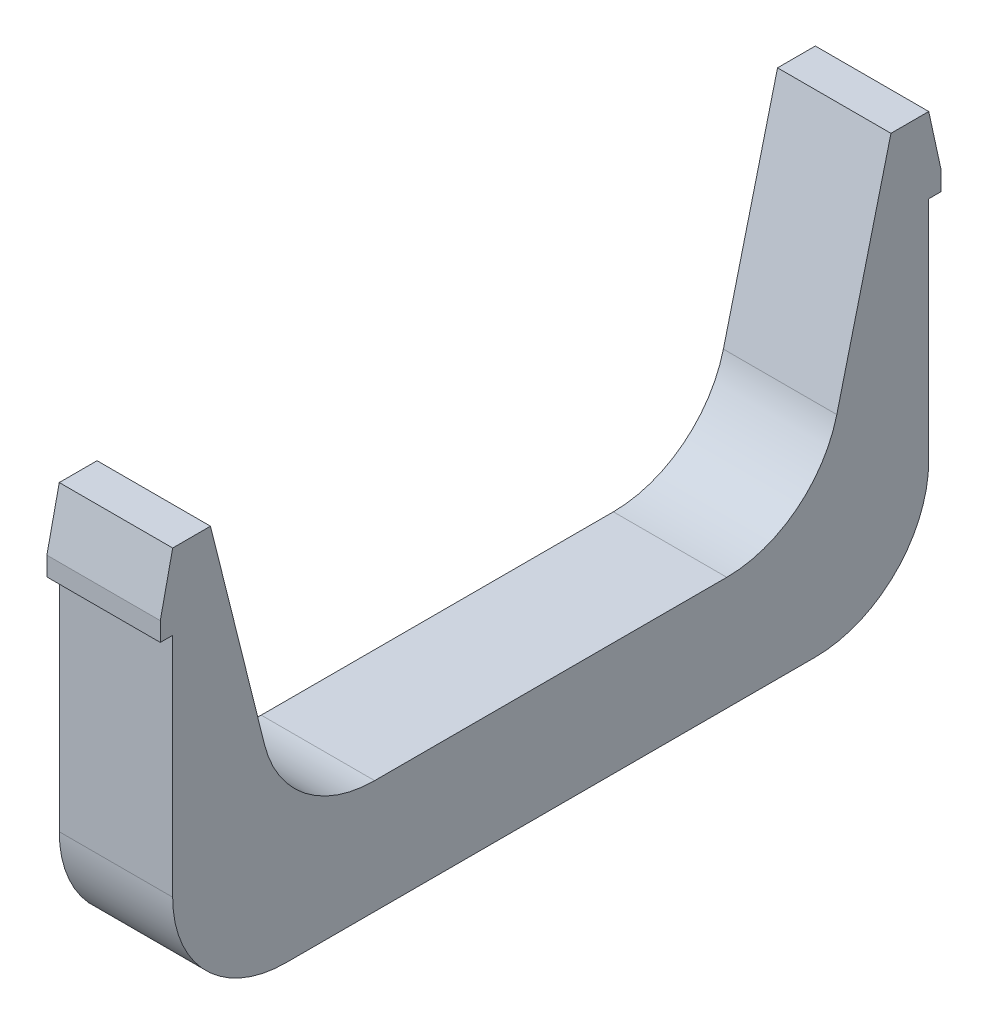
from build123d import *

# Parameters (mm, degrees)
SKETCH1_W           = 20
SKETCH1_H           = 3
EXTRUDE_THIN1_DEPTH = 3
SNAP_START          = -3
SNAP_HOOK1_DEPTH    = 3
FILLET2_R           = 3


# Read off the part's stored shape, not the designer's step: Snap Hook1
with BuildPart() as part:
    # Sketch1 → Extrude-Thin1 (new body)
    with BuildSketch(Plane(origin=(0, 0, 0), x_dir=(0, 0, -1), z_dir=(1, 0, 0))):
        Rectangle(SKETCH1_W, SKETCH1_H)
    extrude(amount=-EXTRUDE_THIN1_DEPTH)

    # Snap Hook1 outline → Snap Hook1 (add)
    with BuildSketch(Plane.YZ.offset(SNAP_START)):
        Polygon((7.5, 10), (1.5, 10), (1.5, 7), (9.5, 9), (9.5, 10), (8, 10.327), (7.5, 10.327), align=None)
    snap_hook1 = extrude(amount=SNAP_HOOK1_DEPTH)

    # Mirror2: Snap Hook1 across plane
    add(snap_hook1.mirror(Plane.XY))

    # Fillet2
    fillet2_edges = [part.edges().sort_by_distance(p)[0] for p in [
        (-1.5, 1.5, 7),
        (-1.5, 1.5, -7),
        (-1.5, -1.5, 10),
        (-1.5, -1.5, -10),
    ]]
    fillet(fillet2_edges, radius=FILLET2_R)


solid = part.part
